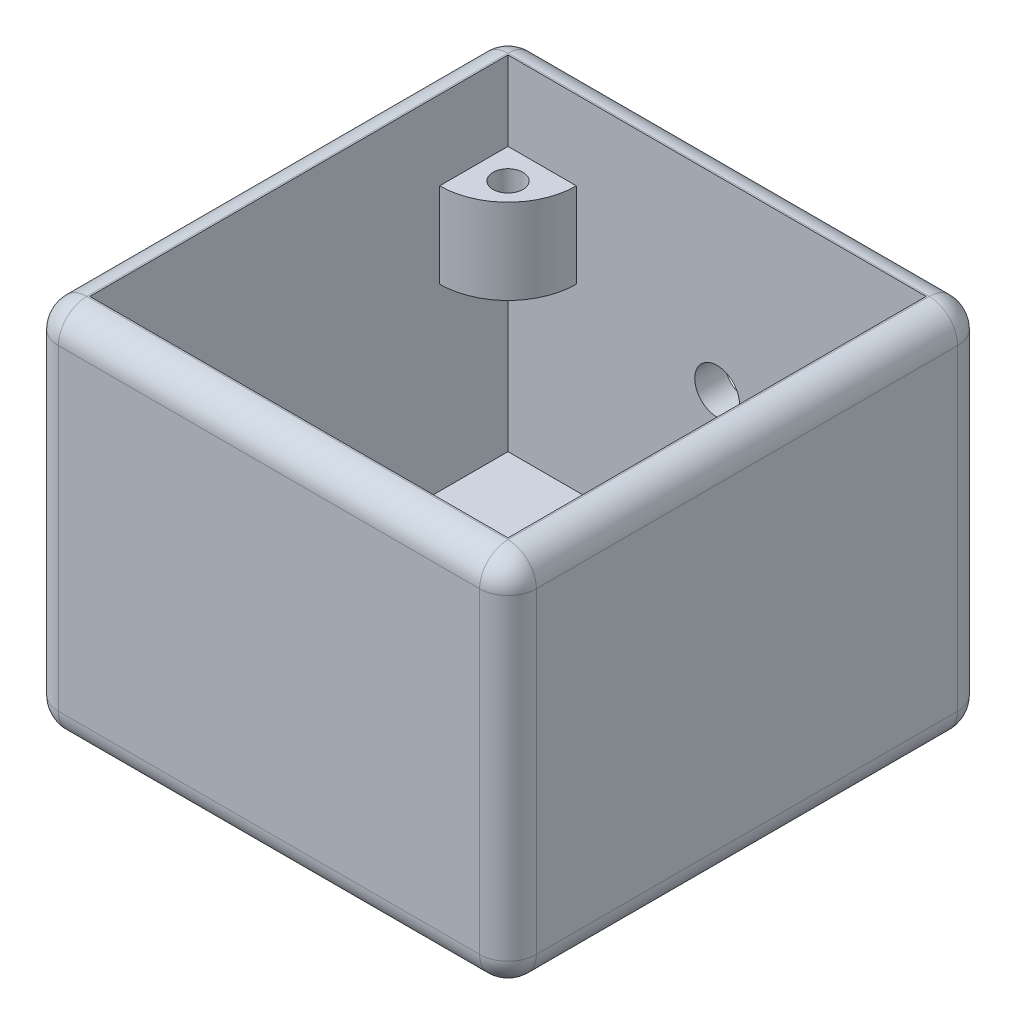
from build123d import *

# Parameters (mm, degrees)
SKETCH_1_W           = 32
SKETCH_1_H           = 32
EXTRUDE_1_DEPTH      = 25
SHELL_1_T            = -2
FILLET_2_R           = 1.9
SKETCH_6_R           = 1
EXTRUDE_3_DEPTH      = 5.7
SKETCH_12_R          = 1.5
CUT_EXTRUDE_5_DEPTH  = 2
SKETCH_13_W          = 3
SKETCH_13_H          = 1.1
CUT_EXTRUDE_7_DEPTH  = 0.8
SKETCH_15_W          = 17.5
SKETCH_15_H          = 1.379565451
CUT_EXTRUDE_13_DEPTH = 0.3
CUT_EXTRUDE_12_DEPTH = 2
SKETCH_17_W          = 10.9
SKETCH_17_H          = 6.2
SKETCH_17_W_2        = 8.9
SKETCH_17_H_2        = 4.2
EXTRUDE_4_DEPTH      = 2.2
SKETCH_19_W          = 8.9
SKETCH_19_H          = 4.2
CUT_EXTRUDE_11_DEPTH = 2


with BuildPart() as part:
    # 草图1 → 凸台-拉伸1 (new body)
    with BuildSketch(Plane(origin=(0, 0, 0), x_dir=(1, 0, 0), z_dir=(0, 1, 0))):
        Rectangle(SKETCH_1_W, SKETCH_1_H)
    extrude(amount=EXTRUDE_1_DEPTH)

    # 抽壳1
    shell_1_openings = [part.faces().sort_by_distance(p)[0] for p in [
        (0, 25, 0),
    ]]
    offset(amount=SHELL_1_T, openings=shell_1_openings, kind=Kind.INTERSECTION)

    # 圆角2
    fillet_2_edges = [part.edges().sort_by_distance(p)[0] for p in [
        (-16, 25, 0),
        (0, 25, -16),
        (-16, 12.5, -16),
        (0, 0, -16),
        (-16, 0, 0),
        (16, 25, 0),
        (16, 12.5, -16),
        (16, 0, 0),
        (-16, 12.5, 16),
        (0, 25, 16),
        (16, 12.5, 16),
        (0, 0, 16),
    ]]
    fillet(fillet_2_edges, radius=FILLET_2_R)

    # 草图6 → 凸台-拉伸3 (add)
    # profile 1 of 4: a face of its own
    with BuildSketch(Plane(origin=(0, 19.7, 0), x_dir=(1, 0, 0), z_dir=(0, 1, 0))):
        with BuildLine():
            Line((-14, 14), (-9.422209932, 14))
            ThreePointArc((-9.422209932, 14), (-10.7630136, 10.7630136), (-14, 9.422209932))
            Line((-14, 9.422209932), (-14, 14))
        make_face()
        with Locations((-12, 12)):
            Circle(SKETCH_6_R, mode=Mode.SUBTRACT)
    # profile 2 of 4: a face of its own
    with BuildSketch(Plane(origin=(0, 19.7, 0), x_dir=(1, 0, 0), z_dir=(0, 1, 0))):
        with BuildLine():
            Line((14, 14), (14, 9.458479825))
            ThreePointArc((14, 9.458479825), (10.788660287, 10.788660287), (9.458479825, 14))
            Line((9.458479825, 14), (14, 14))
        make_face()
        with Locations((12, 12)):
            Circle(SKETCH_6_R, mode=Mode.SUBTRACT)
    # profile 3 of 4: a face of its own
    with BuildSketch(Plane(origin=(0, 19.7, 0), x_dir=(1, 0, 0), z_dir=(0, 1, 0))):
        with BuildLine():
            Line((-14, -9.417689546), (-14, -14))
            Line((-14, -14), (-9.417689546, -14))
            ThreePointArc((-9.417689546, -14), (-10.759817205, -10.759817205), (-14, -9.417689546))
        make_face()
        with Locations((-12, -12)):
            Circle(SKETCH_6_R, mode=Mode.SUBTRACT)
    # profile 4 of 4: a face of its own
    with BuildSketch(Plane(origin=(0, 19.7, 0), x_dir=(1, 0, 0), z_dir=(0, 1, 0))):
        with BuildLine():
            Line((9.370725518, -14), (14, -14))
            Line((14, -14), (14, -9.370725518))
            ThreePointArc((14, -9.370725518), (10.726608622, -10.726608622), (9.370725518, -14))
        make_face()
        with Locations((12, -12)):
            Circle(SKETCH_6_R, mode=Mode.SUBTRACT)
    extrude(amount=-EXTRUDE_3_DEPTH)

    # 草图12 → 切除-拉伸5 (cut)
    with BuildSketch(Plane(origin=(0, 0, -16), x_dir=(-1, 0, 0), z_dir=(0, 0, -1))):
        with Locations((0, 12.5)):
            Circle(SKETCH_12_R)
    extrude(amount=-CUT_EXTRUDE_5_DEPTH, mode=Mode.SUBTRACT)

    # 草图13 → 切除-拉伸7 (cut)
    with BuildSketch(Plane.ZY.offset(-14)):
        with Locations((-4, 2.55)):
            Rectangle(SKETCH_13_W, SKETCH_13_H)
        with Locations((10.5, 2.55)):
            Rectangle(SKETCH_13_W, SKETCH_13_H)
    extrude(amount=-CUT_EXTRUDE_7_DEPTH, mode=Mode.SUBTRACT)

    # 草图15 → 切除-拉伸13 (cut)
    with BuildSketch(Plane(origin=(-14, 0, 0), x_dir=(0, 0, -1), z_dir=(1, 0, 0))):
        with Locations((-3.25, 2.689782726)):
            Rectangle(SKETCH_15_W, SKETCH_15_H)
    extrude(amount=-CUT_EXTRUDE_13_DEPTH, mode=Mode.SUBTRACT)

    # 草图16 → 切除-拉伸12 (cut)
    with BuildSketch(Plane.ZY.offset(16)):
        with BuildLine():
            Line((0.1, 6.75), (6.4, 6.75))
            ThreePointArc((6.4, 6.75), (8.15, 5), (6.4, 3.25))
            Line((6.4, 3.25), (0.1, 3.25))
            ThreePointArc((0.1, 3.25), (-1.65, 5), (0.1, 6.75))
        make_face()
    extrude(amount=-CUT_EXTRUDE_12_DEPTH, mode=Mode.SUBTRACT)

    # 草图17 → 凸台-拉伸4 (add)
    with BuildSketch(Plane(origin=(0, 2, 0), x_dir=(1, 0, 0), z_dir=(0, 1, 0))):
        with Locations((-0.05, 10.9)):
            Rectangle(SKETCH_17_W, SKETCH_17_H)
        with Locations((-0.05, 10.9)):
            Rectangle(SKETCH_17_W_2, SKETCH_17_H_2, mode=Mode.SUBTRACT)
    extrude(amount=EXTRUDE_4_DEPTH)

    # 草图19 → 切除-拉伸11 (cut)
    with BuildSketch(Plane.XZ):
        with Locations((-0.05, -10.9)):
            Rectangle(SKETCH_19_W, SKETCH_19_H)
    extrude(amount=-CUT_EXTRUDE_11_DEPTH, mode=Mode.SUBTRACT)


solid = part.part
